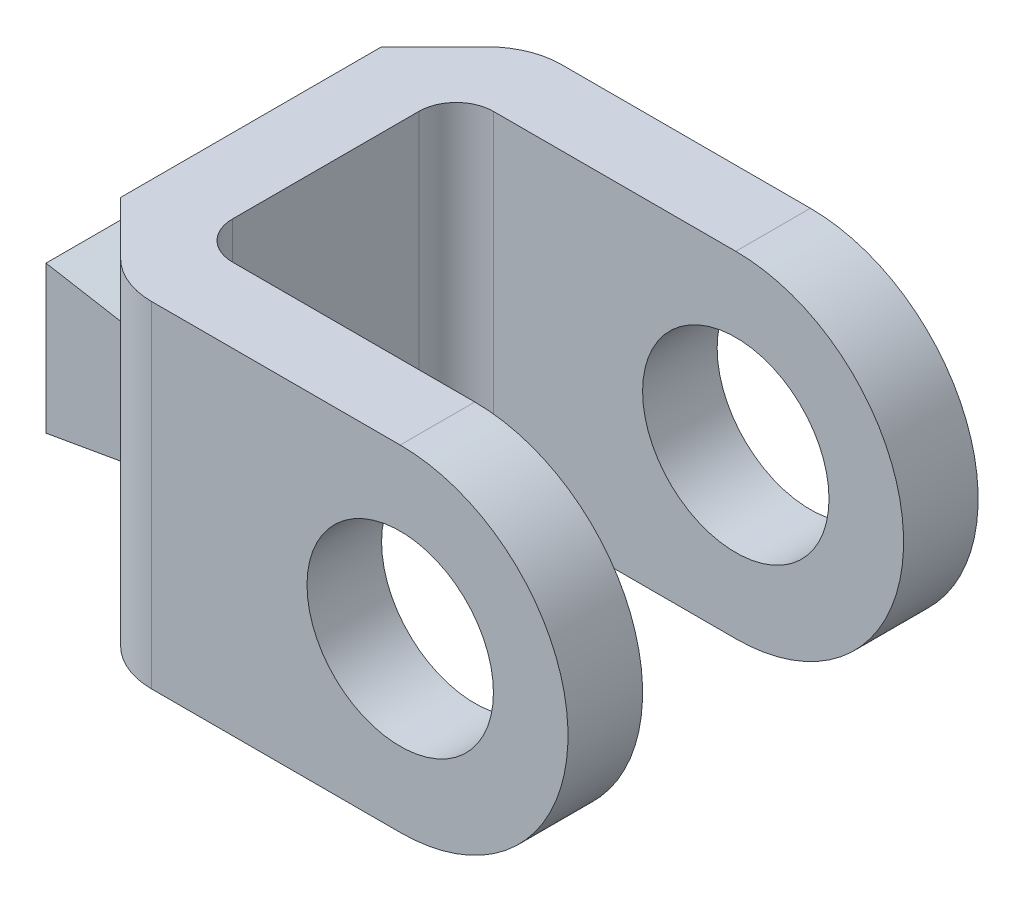
from build123d import *

# Parameters (mm, degrees)
BOSS_EXTRUDE2_DEPTH  = 7
SKETCH2_R            = 2.5
BOSS_EXTRUDE3_DEPTH  = 2
CUT_EXTRUDE3_DEPTH   = 19.055470085
FILLET1_R            = 1
FILLET2_R            = 2
FILLET2_OF_MIRROR2_R = 2
FILLET3_R            = 1


with BuildPart() as part:
    # Sketch1 → Boss-Extrude2 (new body)
    with BuildSketch(Plane.XY):
        Polygon((0, -1.625), (-2, -1.975), (-2, 1.975), (0, 1.625), (0, 4.5), (2, 4.5), (2, -4.5), (0, -4.5), align=None)
    boss_extrude2 = extrude(amount=BOSS_EXTRUDE2_DEPTH)

    # Sketch2 → Boss-Extrude3 (add)
    with BuildSketch(Plane.XY):
        with BuildLine():
            Line((0, 4.5), (9.5, 4.5))
            ThreePointArc((9.5, 4.5), (14, 0), (9.5, -4.5))
            Line((9.5, -4.5), (0, -4.5))
            Line((0, -4.5), (0, 4.5))
        make_face()
        with Locations((9.5, 0)):
            Circle(SKETCH2_R, mode=Mode.SUBTRACT)
    boss_extrude3 = extrude(amount=-BOSS_EXTRUDE3_DEPTH)

    # Sketch4 → Cut-Extrude3 (cut, through all)
    with BuildSketch(Plane(origin=(0, 4.5, 0), x_dir=(1, 0, 0), z_dir=(0, 1, 0))):
        Polygon((0, 0), (2, 2), (0, 2), align=None)
    cut_extrude3 = extrude(amount=-CUT_EXTRUDE3_DEPTH, mode=Mode.SUBTRACT)

    # Fillet1
    fillet1_edges = [part.edges().sort_by_distance(p)[0] for p in [
        (2, 0, 0),
    ]]
    fillet(fillet1_edges, radius=FILLET1_R)

    # Fillet2
    fillet2_edges = [part.edges().sort_by_distance(p)[0] for p in [
        (2, 0, -2),
    ]]
    fillet(fillet2_edges, radius=FILLET2_R)

    # Mirror2: Boss-Extrude2, Boss-Extrude3, Cut-Extrude3 across plane
    add(boss_extrude2.mirror(Plane.XY.offset(3.5)))
    add(boss_extrude3.mirror(Plane.XY.offset(3.5)))
    add(cut_extrude3.mirror(Plane.XY.offset(3.5)), mode=Mode.SUBTRACT)

    # Fillet2 of Mirror2
    fillet2_of_mirror2_edges = [part.edges().sort_by_distance(p)[0] for p in [
        (2, 0, 9),
    ]]
    fillet(fillet2_of_mirror2_edges, radius=FILLET2_OF_MIRROR2_R)

    # Fillet3
    fillet3_edges = [part.edges().sort_by_distance(p)[0] for p in [
        (2, 0, 7),
    ]]
    fillet(fillet3_edges, radius=FILLET3_R)


solid = part.part
